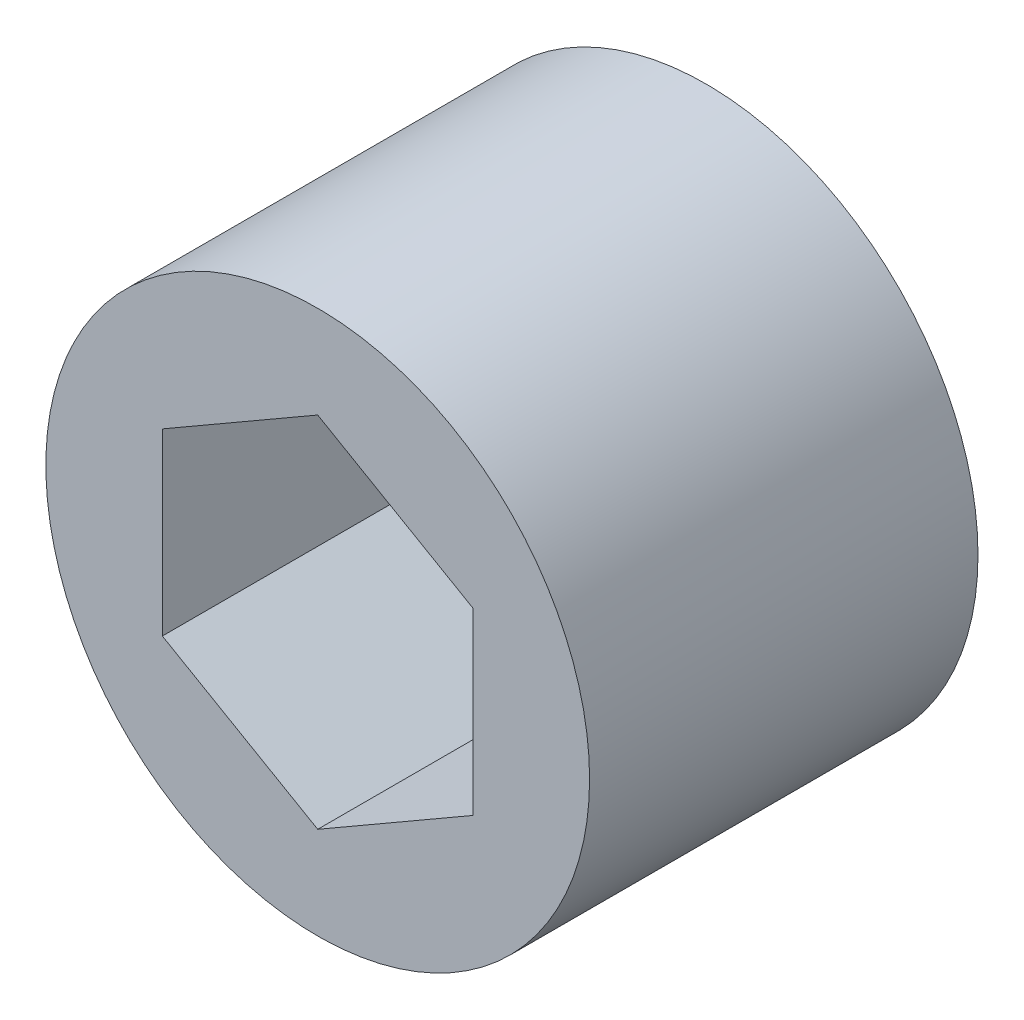
from build123d import *

# Parameters (mm, degrees)
SKETCH1_R           = 11.1125
BOSS_EXTRUDE1_DEPTH = 15.875
CUT_EXTRUDE1_DEPTH  = 0.4


with BuildPart() as part:
    # Sketch1 → Boss-Extrude1 (new body)
    with BuildSketch(Plane.XY):
        Circle(SKETCH1_R)
        Polygon((0, 7.332348419), (-6.35, 3.666174209), (-6.35, -3.666174209), (0, -7.332348419), (6.35, -3.666174209), (6.35, 3.666174209), align=None, mode=Mode.SUBTRACT)
    extrude(amount=BOSS_EXTRUDE1_DEPTH)

    # Sketch2 → Cut-Extrude1 (cut)
    # profile 1 of 4: a face of its own
    with BuildSketch(Plane(origin=(0, 0, 0), x_dir=(-1, 0, 0), z_dir=(0, 0, -1))):
        with BuildLine():
            add(Edge.make_bspline(
                [(-6.352447409, 5.46601662), (-6.367108142, 5.491759391), (-6.395621123, 5.541825319), (-6.434002282, 5.616497456), (-6.468359259, 5.687614023), (-6.497743051, 5.755548608), (-6.522422123, 5.820121118), (-6.542086985, 5.881464986), (-6.55767301, 5.939456115), (-6.568059534, 5.994678232), (-6.574440803, 6.047496191), (-6.577292558, 6.098295072), (-6.577661127, 6.147516254), (-6.573662053, 6.195089528), (-6.567271468, 6.241155527), (-6.556993719, 6.28547166), (-6.544280054, 6.328459991), (-6.527262591, 6.369391136), (-6.508350524, 6.408878349), (-6.485621715, 6.445581989), (-6.461447378, 6.480665288), (-6.434058564, 6.512892821), (-6.404712005, 6.543343079), (-6.372290353, 6.570922258), (-6.337760284, 6.596875684), (-6.31300831, 6.61189916), (-6.30050597, 6.61948759)],
                knots=[0, 0, 0, 0, 1.642146609, 3.193735178, 4.65339879, 6.019959045, 7.29583452, 8.483997703, 9.589852514, 10.622536898, 11.596230804, 12.537100014, 13.442089292, 14.322328697, 15.181380451, 16.017978509, 16.842123126, 17.663296608, 18.472766854, 19.266433458, 20.053886789, 20.832515994, 21.608242113, 22.395755133, 23.189688203, 24, 24, 24, 24], degree=3))
            add(Edge.make_bspline(
                [(-6.30050597, 6.61948759), (-6.28750665, 6.626634682), (-6.261735674, 6.640803695), (-6.221380783, 6.658035255), (-6.180735845, 6.672738376), (-6.139111256, 6.683516346), (-6.096922894, 6.690898355), (-6.053879725, 6.695019553), (-6.010214005, 6.695734269), (-5.965952996, 6.693054051), (-5.921342934, 6.687318732), (-5.876711205, 6.677119393), (-5.832178063, 6.663199823), (-5.78728422, 6.646325663), (-5.743036739, 6.624527381), (-5.698593396, 6.599476485), (-5.65401976, 6.571045705), (-5.60985049, 6.538081727), (-5.565178054, 6.50116605), (-5.520975463, 6.458862077), (-5.476577629, 6.411476758), (-5.432650593, 6.358832155), (-5.38886047, 6.300949976), (-5.344546027, 6.23833873), (-5.301005451, 6.17000965), (-5.272792391, 6.12229343), (-5.258338085, 6.097847132)],
                knots=[0, 0, 0, 0, 0.816106898, 1.617920902, 2.412419145, 3.193416184, 3.981325097, 4.767762218, 5.571164061, 6.382658378, 7.20678923, 8.044113261, 8.898964452, 9.773829128, 10.681145665, 11.610813622, 12.5814274, 13.588962241, 14.6427423, 15.769503862, 16.954284862, 18.215513191, 19.541650863, 20.948716096, 22.436745513, 24, 24, 24, 24], degree=3))
            add(Edge.make_bspline(
                [(-5.258338085, 6.097847132), (-5.244481112, 6.07318509), (-5.217455933, 6.025086842), (-5.180098696, 5.953550371), (-5.148010678, 5.884204459), (-5.119842282, 5.817618337), (-5.096549561, 5.753565937), (-5.077338141, 5.69209328), (-5.062820723, 5.633119837), (-5.052610272, 5.576476826), (-5.046929836, 5.521902926), (-5.043552399, 5.469397057), (-5.044594526, 5.418589453), (-5.047933533, 5.369446788), (-5.055598416, 5.32201595), (-5.0658179, 5.276193286), (-5.079575592, 5.232250503), (-5.096760015, 5.190275581), (-5.116623965, 5.150270336), (-5.139586254, 5.112689518), (-5.164239384, 5.0769568), (-5.191778572, 5.043657006), (-5.222545454, 5.013384724), (-5.255022619, 4.984723017), (-5.290173202, 4.95838192), (-5.31533625, 4.943177163), (-5.328088018, 4.935471915)],
                knots=[0, 0, 0, 0, 1.558572261, 3.039675171, 4.44500239, 5.767404933, 7.021920233, 8.19867626, 9.314183841, 10.366093107, 11.366862767, 12.335955634, 13.262731656, 14.164729598, 15.047477431, 15.907015182, 16.749641984, 17.580952634, 18.403702246, 19.207672054, 20.005351578, 20.794016824, 21.584181799, 22.380929523, 23.179510693, 24, 24, 24, 24], degree=3))
            add(Edge.make_bspline(
                [(-5.328088018, 4.935471915), (-5.340860293, 4.928497876), (-5.366220807, 4.914650288), (-5.405549591, 4.897067096), (-5.445898764, 4.883519617), (-5.486589696, 4.872472482), (-5.528121305, 4.865648403), (-5.570133031, 4.861391482), (-5.61293337, 4.860767204), (-5.65625854, 4.863202441), (-5.699746833, 4.869760417), (-5.743310401, 4.879121757), (-5.786420751, 4.893264302), (-5.829651288, 4.910251953), (-5.872741185, 4.931200275), (-5.915803105, 4.95565252), (-5.958528298, 4.984122906), (-6.001576223, 5.016069935), (-6.0443443, 5.053145793), (-6.08759947, 5.095363829), (-6.131241423, 5.143144176), (-6.174945248, 5.196837835), (-6.21921984, 5.255944024), (-6.263412052, 5.320910023), (-6.308618261, 5.391132786), (-6.337543193, 5.440552176), (-6.352447409, 5.46601662)],
                knots=[0, 0, 0, 0, 0.807491903, 1.603348545, 2.386916451, 3.167713854, 3.940658363, 4.719915701, 5.50935356, 6.313835313, 7.125313705, 7.947948844, 8.783651521, 9.640150085, 10.524255013, 11.440287308, 12.386399569, 13.372019105, 14.413529699, 15.525036669, 16.724996316, 18.002813491, 19.365932914, 20.822335035, 22.362637201, 24, 24, 24, 24], degree=3))
        make_face()
        with BuildLine():
            add(Edge.make_bspline(
                [(-6.199220162, 5.550235954), (-6.18648845, 5.528392015), (-6.161834291, 5.486092605), (-6.123879467, 5.425894145), (-6.086777338, 5.370668578), (-6.050967607, 5.32007539), (-6.015779664, 5.274683279), (-5.9811789, 5.234603071), (-5.947854359, 5.199079744), (-5.914974729, 5.168379546), (-5.882287075, 5.141731532), (-5.849614093, 5.118242129), (-5.816598714, 5.0978625), (-5.783536667, 5.080302079), (-5.750160831, 5.065725606), (-5.716647435, 5.053707842), (-5.682652667, 5.045336635), (-5.638131171, 5.037362842), (-5.583459741, 5.034309812), (-5.520286202, 5.040621033), (-5.460502213, 5.056215235), (-5.42439821, 5.074664273), (-5.406371187, 5.083876028)],
                knots=[0, 0, 0, 0, 1.475228016, 2.856686104, 4.15161897, 5.357081144, 6.47289893, 7.501387829, 8.445726694, 9.313720896, 10.124066195, 10.905058304, 11.660046733, 12.386348828, 13.08755313, 13.783651734, 14.460982071, 15.127735434, 16.421461315, 17.639985157, 18.821625413, 20, 20, 20, 20], degree=3))
            add(Edge.make_bspline(
                [(-5.406371187, 5.083876028), (-5.389196577, 5.094759252), (-5.354909138, 5.116486551), (-5.311793963, 5.160446333), (-5.274913343, 5.211060465), (-5.250718382, 5.259031175), (-5.235567388, 5.300757875), (-5.226257597, 5.333832299), (-5.220000988, 5.368492533), (-5.21618534, 5.404336081), (-5.215781399, 5.441788987), (-5.216997489, 5.480471538), (-5.221659262, 5.520609629), (-5.226528442, 5.547540166), (-5.229028272, 5.561366262)],
                knots=[0, 0, 0, 0, 1.337971097, 2.671129108, 4.032665881, 5.459843453, 6.198285547, 6.96065115, 7.724239053, 8.5201198, 9.33645292, 10.194052936, 11.072829554, 12, 12, 12, 12], degree=3))
            add(Edge.make_bspline(
                [(-5.229028272, 5.561366262), (-5.232530662, 5.578728772), (-5.239658842, 5.614065523), (-5.254478662, 5.667078109), (-5.271898019, 5.721466204), (-5.292594726, 5.776801269), (-5.316654413, 5.833108704), (-5.343270654, 5.890636158), (-5.373326373, 5.9493163), (-5.395463044, 5.988233444), (-5.406742198, 6.008062643)],
                knots=[0, 0, 0, 0, 0.879876913, 1.790754508, 2.73331625, 3.717259664, 4.725112015, 5.77538776, 6.866507818, 8, 8, 8, 8], degree=3))
            add(Edge.make_bspline(
                [(-5.406742198, 6.008062643), (-5.418214527, 6.027696076), (-5.440661139, 6.066110601), (-5.476094162, 6.120783234), (-5.510832774, 6.172280175), (-5.546066686, 6.219856304), (-5.581724372, 6.263457268), (-5.616906493, 6.303875654), (-5.652547165, 6.340199169), (-5.688245303, 6.372986792), (-5.723860028, 6.402244198), (-5.758981944, 6.428400536), (-5.794192991, 6.450737266), (-5.828999812, 6.470227515), (-5.863800539, 6.486071109), (-5.898205642, 6.498953509), (-5.932478988, 6.508320661), (-5.977145137, 6.51593515), (-6.031491491, 6.519069372), (-6.094247076, 6.513346398), (-6.153453113, 6.497606282), (-6.189222062, 6.479397437), (-6.207011378, 6.470341456)],
                knots=[0, 0, 0, 0, 1.327522451, 2.597413504, 3.803087542, 4.954092809, 6.052504639, 7.091116491, 8.08170511, 9.022070092, 9.919800897, 10.771882377, 11.577119672, 12.352806521, 13.099205072, 13.807429758, 14.495830891, 15.170113202, 16.450227669, 17.661618134, 18.837030004, 20, 20, 20, 20], degree=3))
            add(Edge.make_bspline(
                [(-6.207011378, 6.470341456), (-6.224172986, 6.459314494), (-6.258375281, 6.437338266), (-6.301793121, 6.393232092), (-6.339005074, 6.341975894), (-6.363075747, 6.293089048), (-6.379089013, 6.251110722), (-6.387683484, 6.217557563), (-6.394526072, 6.182906704), (-6.398689439, 6.146802253), (-6.399456285, 6.109349529), (-6.398653247, 6.070659896), (-6.394145074, 6.030823963), (-6.388058948, 5.989240744), (-6.378194821, 5.945338623), (-6.364324856, 5.898537886), (-6.346297305, 5.848509335), (-6.324786694, 5.794980809), (-6.299086515, 5.738391503), (-6.26956614, 5.678425582), (-6.236364061, 5.615091437), (-6.211853278, 5.572294133), (-6.199220162, 5.550235954)],
                knots=[0, 0, 0, 0, 1.186584607, 2.364808541, 3.584028067, 4.867913378, 5.52979883, 6.201670858, 6.884946004, 7.589109066, 8.317961587, 9.068444384, 9.84432244, 10.65432116, 11.518850237, 12.466086659, 13.499587148, 14.619373863, 15.830028341, 17.123623296, 18.517485242, 20, 20, 20, 20], degree=3))
        make_face(mode=Mode.SUBTRACT)
    # profile 2 of 4: a face of its own
    with BuildSketch(Plane(origin=(0, 0, 0), x_dir=(-1, 0, 0), z_dir=(0, 0, -1))):
        with BuildLine():
            add(Edge.make_bspline(
                [(-5.118638781, 6.178356363), (-5.133299513, 6.204099134), (-5.161812495, 6.254165063), (-5.200193654, 6.3288372), (-5.234550631, 6.399953767), (-5.263934423, 6.467888351), (-5.288613494, 6.532460861), (-5.308278357, 6.59380473), (-5.323864382, 6.651795858), (-5.334250905, 6.707017976), (-5.340632175, 6.759835935), (-5.34348393, 6.810634816), (-5.343852499, 6.859855998), (-5.339853425, 6.907429271), (-5.33346284, 6.953495271), (-5.323185091, 6.997811404), (-5.310471426, 7.040799735), (-5.293453963, 7.081730879), (-5.274541896, 7.121218093), (-5.251813087, 7.157921733), (-5.22763875, 7.193005031), (-5.200249936, 7.225232565), (-5.170903377, 7.255682823), (-5.138481725, 7.283262002), (-5.103951655, 7.309215428), (-5.079199682, 7.324238904), (-5.066697342, 7.331827333)],
                knots=[0, 0, 0, 0, 1.642146609, 3.193735178, 4.65339879, 6.019959045, 7.29583452, 8.483997703, 9.589852514, 10.622536898, 11.596230804, 12.537100014, 13.442089292, 14.322328697, 15.181380451, 16.017978509, 16.842123126, 17.663296608, 18.472766854, 19.266433458, 20.053886789, 20.832515994, 21.608242113, 22.395755133, 23.189688203, 24, 24, 24, 24], degree=3))
            add(Edge.make_bspline(
                [(-5.066697342, 7.331827333), (-5.053698022, 7.338974425), (-5.027927046, 7.353143439), (-4.987572155, 7.370374999), (-4.946927216, 7.385078119), (-4.905302628, 7.395856089), (-4.863114266, 7.403238099), (-4.820071097, 7.407359296), (-4.776405377, 7.408074012), (-4.732144368, 7.405393795), (-4.687534306, 7.399658475), (-4.642902577, 7.389459137), (-4.598369435, 7.375539567), (-4.553475592, 7.358665407), (-4.509228111, 7.336867125), (-4.464784768, 7.311816229), (-4.420211132, 7.283385448), (-4.376041862, 7.250421471), (-4.331369426, 7.213505794), (-4.287166834, 7.171201821), (-4.242769001, 7.123816501), (-4.198841965, 7.071171898), (-4.155051842, 7.013289719), (-4.110737399, 6.950678473), (-4.067196823, 6.882349393), (-4.038983763, 6.834633173), (-4.024529456, 6.810186875)],
                knots=[0, 0, 0, 0, 0.816106898, 1.617920902, 2.412419145, 3.193416184, 3.981325097, 4.767762218, 5.571164061, 6.382658378, 7.20678923, 8.044113261, 8.898964452, 9.773829128, 10.681145665, 11.610813622, 12.5814274, 13.588962241, 14.6427423, 15.769503862, 16.954284862, 18.215513191, 19.541650863, 20.948716096, 22.436745513, 24, 24, 24, 24], degree=3))
            add(Edge.make_bspline(
                [(-4.024529456, 6.810186875), (-4.010672484, 6.785524834), (-3.983647304, 6.737426585), (-3.946290068, 6.665890114), (-3.91420205, 6.596544202), (-3.886033654, 6.52995808), (-3.862740933, 6.46590568), (-3.843529513, 6.404433024), (-3.829012095, 6.34545958), (-3.818801644, 6.28881657), (-3.813121208, 6.23424267), (-3.809743771, 6.1817368), (-3.810785898, 6.130929197), (-3.814124904, 6.081786532), (-3.821789788, 6.034355694), (-3.832009272, 5.988533029), (-3.845766964, 5.944590247), (-3.862951387, 5.902615324), (-3.882815337, 5.862610079), (-3.905777626, 5.825029262), (-3.930430755, 5.789296543), (-3.957969944, 5.75599675), (-3.988736826, 5.725724468), (-4.021213991, 5.697062761), (-4.056364574, 5.670721664), (-4.081527621, 5.655516907), (-4.09427939, 5.647811658)],
                knots=[0, 0, 0, 0, 1.558572261, 3.039675171, 4.44500239, 5.767404933, 7.021920233, 8.19867626, 9.314183841, 10.366093107, 11.366862767, 12.335955634, 13.262731656, 14.164729598, 15.047477431, 15.907015182, 16.749641984, 17.580952634, 18.403702246, 19.207672054, 20.005351578, 20.794016824, 21.584181799, 22.380929523, 23.179510693, 24, 24, 24, 24], degree=3))
            add(Edge.make_bspline(
                [(-4.09427939, 5.647811658), (-4.107051665, 5.640837619), (-4.132412179, 5.626990031), (-4.171740963, 5.60940684), (-4.212090136, 5.595859361), (-4.252781068, 5.584812225), (-4.294312677, 5.577988147), (-4.336324403, 5.573731226), (-4.379124742, 5.573106947), (-4.422449912, 5.575542185), (-4.465938205, 5.582100161), (-4.509501773, 5.5914615), (-4.552612123, 5.605604045), (-4.59584266, 5.622591697), (-4.638932557, 5.643540019), (-4.681994477, 5.667992264), (-4.72471967, 5.69646265), (-4.767767594, 5.728409679), (-4.810535672, 5.765485536), (-4.853790842, 5.807703572), (-4.897432795, 5.85548392), (-4.94113662, 5.909177579), (-4.985411212, 5.968283767), (-5.029603424, 6.033249766), (-5.074809633, 6.103472529), (-5.103734565, 6.152891919), (-5.118638781, 6.178356363)],
                knots=[0, 0, 0, 0, 0.807491903, 1.603348545, 2.386916451, 3.167713854, 3.940658363, 4.719915701, 5.50935356, 6.313835313, 7.125313705, 7.947948844, 8.783651521, 9.640150085, 10.524255013, 11.440287308, 12.386399569, 13.372019105, 14.413529699, 15.525036669, 16.724996316, 18.002813491, 19.365932914, 20.822335035, 22.362637201, 24, 24, 24, 24], degree=3))
        make_face()
        with BuildLine():
            add(Edge.make_bspline(
                [(-4.965411534, 6.262575697), (-4.952679822, 6.240731759), (-4.928025663, 6.198432348), (-4.890070839, 6.138233888), (-4.852968709, 6.083008322), (-4.817158978, 6.032415134), (-4.781971036, 5.987023023), (-4.747370272, 5.946942814), (-4.714045731, 5.911419488), (-4.681166101, 5.88071929), (-4.648478447, 5.854071276), (-4.615805465, 5.830581873), (-4.582790086, 5.810202243), (-4.549728039, 5.792641822), (-4.516352203, 5.778065349), (-4.482838807, 5.766047585), (-4.448844039, 5.757676379), (-4.404322543, 5.749702586), (-4.349651113, 5.746649556), (-4.286477573, 5.752960777), (-4.226693584, 5.768554979), (-4.190589581, 5.787004017), (-4.172562559, 5.796215772)],
                knots=[0, 0, 0, 0, 1.475228016, 2.856686104, 4.15161897, 5.357081144, 6.47289893, 7.501387829, 8.445726694, 9.313720896, 10.124066195, 10.905058304, 11.660046733, 12.386348828, 13.08755313, 13.783651734, 14.460982071, 15.127735434, 16.421461315, 17.639985157, 18.821625413, 20, 20, 20, 20], degree=3))
            add(Edge.make_bspline(
                [(-4.172562559, 5.796215772), (-4.155387949, 5.807098996), (-4.121100509, 5.828826294), (-4.077985335, 5.872786077), (-4.041104715, 5.923400209), (-4.016909754, 5.971370918), (-4.00175876, 6.013097618), (-3.992448969, 6.046172042), (-3.98619236, 6.080832276), (-3.982376712, 6.116675825), (-3.981972771, 6.154128731), (-3.983188861, 6.192811281), (-3.987850634, 6.232949373), (-3.992719814, 6.25987991), (-3.995219644, 6.273706006)],
                knots=[0, 0, 0, 0, 1.337971097, 2.671129108, 4.032665881, 5.459843453, 6.198285547, 6.96065115, 7.724239053, 8.5201198, 9.33645292, 10.194052936, 11.072829554, 12, 12, 12, 12], degree=3))
            add(Edge.make_bspline(
                [(-3.995219644, 6.273706006), (-3.998722034, 6.291068515), (-4.005850214, 6.326405266), (-4.020670034, 6.379417853), (-4.038089391, 6.433805947), (-4.058786097, 6.489141013), (-4.082845785, 6.545448447), (-4.109462026, 6.602975901), (-4.139517745, 6.661656043), (-4.161654416, 6.700573188), (-4.17293357, 6.720402387)],
                knots=[0, 0, 0, 0, 0.879876913, 1.790754508, 2.73331625, 3.717259664, 4.725112015, 5.77538776, 6.866507818, 8, 8, 8, 8], degree=3))
            add(Edge.make_bspline(
                [(-4.17293357, 6.720402387), (-4.184405898, 6.74003582), (-4.206852511, 6.778450344), (-4.242285534, 6.833122978), (-4.277024145, 6.884619919), (-4.312258058, 6.932196048), (-4.347915744, 6.975797011), (-4.383097865, 7.016215398), (-4.418738537, 7.052538912), (-4.454436675, 7.085326536), (-4.4900514, 7.114583942), (-4.525173316, 7.140740279), (-4.560384363, 7.16307701), (-4.595191184, 7.182567258), (-4.629991911, 7.198410853), (-4.664397013, 7.211293252), (-4.69867036, 7.220660405), (-4.743336509, 7.228274893), (-4.797682863, 7.231409115), (-4.860438448, 7.225686142), (-4.919644485, 7.209946026), (-4.955413434, 7.19173718), (-4.97320275, 7.1826812)],
                knots=[0, 0, 0, 0, 1.327522451, 2.597413504, 3.803087542, 4.954092809, 6.052504639, 7.091116491, 8.08170511, 9.022070092, 9.919800897, 10.771882377, 11.577119672, 12.352806521, 13.099205072, 13.807429758, 14.495830891, 15.170113202, 16.450227669, 17.661618134, 18.837030004, 20, 20, 20, 20], degree=3))
            add(Edge.make_bspline(
                [(-4.97320275, 7.1826812), (-4.990364358, 7.171654238), (-5.024566652, 7.14967801), (-5.067984493, 7.105571835), (-5.105196446, 7.054315637), (-5.129267119, 7.005428791), (-5.145280385, 6.963450465), (-5.153874856, 6.929897307), (-5.160717444, 6.895246447), (-5.164880811, 6.859141997), (-5.165647656, 6.821689272), (-5.164844619, 6.78299964), (-5.160336446, 6.743163706), (-5.15425032, 6.701580488), (-5.144386193, 6.657678367), (-5.130516227, 6.610877629), (-5.112488677, 6.560849079), (-5.090978065, 6.507320553), (-5.065277886, 6.450731247), (-5.035757512, 6.390765325), (-5.002555433, 6.32743118), (-4.978044649, 6.284633877), (-4.965411534, 6.262575697)],
                knots=[0, 0, 0, 0, 1.186584607, 2.364808541, 3.584028067, 4.867913378, 5.52979883, 6.201670858, 6.884946004, 7.589109066, 8.317961587, 9.068444384, 9.84432244, 10.65432116, 11.518850237, 12.466086659, 13.499587148, 14.619373863, 15.830028341, 17.123623296, 18.517485242, 20, 20, 20, 20], degree=3))
        make_face(mode=Mode.SUBTRACT)
    # profile 3 of 4: a face of its own
    with BuildSketch(Plane(origin=(0, 0, 0), x_dir=(-1, 0, 0), z_dir=(0, 0, -1))):
        Polygon((-4.006150516, 7.89056882), (-3.691162785, 8.072363859), (-2.765121119, 6.469228425), (-2.92428453, 6.377217875), (-3.759428677, 7.823415959), (-4.010973649, 7.678350938), align=None)
    # profile 4 of 4: a face of its own
    with BuildSketch(Plane(origin=(0, 0, 0), x_dir=(-1, 0, 0), z_dir=(0, 0, -1))):
        with BuildLine():
            Line((-1.807715151, 6.967866246), (-1.988397159, 6.976770492))
            Line((-1.988397159, 6.976770492), (-1.934971679, 7.883148614))
            add(Edge.make_bspline(
                [(-1.934971679, 7.883148614), (-1.946623442, 7.870433919), (-1.969288705, 7.845701021), (-2.006103594, 7.813243662), (-2.042666278, 7.783968527), (-2.068726823, 7.768123177), (-2.08152074, 7.76034421)],
                knots=[0, 0, 0, 0, 1.077215196, 2.095422277, 3.064984682, 4, 4, 4, 4], degree=3))
            add(Edge.make_bspline(
                [(-2.08152074, 7.76034421), (-2.097313418, 7.751726524), (-2.128559927, 7.734676052), (-2.177630339, 7.715195752), (-2.227308114, 7.700769843), (-2.277752169, 7.692462787), (-2.328799598, 7.688494624), (-2.380565355, 7.690422594), (-2.432949567, 7.698125309), (-2.485377896, 7.710555556), (-2.536717435, 7.727854735), (-2.585572744, 7.749814209), (-2.631467207, 7.776257146), (-2.674219845, 7.807243883), (-2.714203482, 7.842292661), (-2.751040907, 7.881766532), (-2.784659021, 7.925892437), (-2.804271064, 7.95779001), (-2.81426605, 7.974046134)],
                knots=[0, 0, 0, 0, 1.014700259, 2.007629186, 2.973189836, 3.929139397, 4.888015433, 5.858935806, 6.846130973, 7.872173019, 8.896432606, 9.899347103, 10.890728972, 11.880733647, 12.874937698, 13.887402481, 14.923346105, 16, 16, 16, 16], degree=3))
            add(Edge.make_bspline(
                [(-2.81426605, 7.974046134), (-2.82654775, 7.997000217), (-2.850711714, 8.042161848), (-2.875178767, 8.114061204), (-2.891116372, 8.186752723), (-2.89549863, 8.260471085), (-2.891098, 8.334038248), (-2.875442442, 8.406248191), (-2.850320322, 8.476737934), (-2.815530297, 8.544502822), (-2.772315496, 8.608089686), (-2.72178062, 8.665506042), (-2.663989494, 8.715766067), (-2.620865233, 8.742833251), (-2.599080085, 8.756506821)],
                knots=[0, 0, 0, 0, 1.035043885, 2.036425051, 3.012843765, 3.989957597, 4.96707143, 5.938672781, 6.921477915, 7.938942164, 8.963306408, 9.975034649, 10.977045218, 12, 12, 12, 12], degree=3))
            add(Edge.make_bspline(
                [(-2.599080085, 8.756506821), (-2.576861184, 8.768394993), (-2.532921588, 8.791904775), (-2.462430956, 8.815836774), (-2.390103585, 8.830480529), (-2.316400354, 8.835614904), (-2.242613681, 8.831386771), (-2.170493924, 8.816685717), (-2.100553172, 8.792433699), (-2.034448672, 8.757746294), (-1.97252963, 8.715699829), (-1.916850108, 8.66652048), (-1.868318335, 8.61040503), (-1.842073533, 8.56864746), (-1.828862738, 8.547628031)],
                knots=[0, 0, 0, 0, 1.019824978, 2.016782805, 3.003623728, 4.003449708, 5.002622273, 5.989463196, 6.976952975, 7.992384263, 9.005785083, 10.003448133, 10.994999479, 12, 12, 12, 12], degree=3))
            add(Edge.make_bspline(
                [(-1.828862738, 8.547628031), (-1.819751807, 8.530596458), (-1.801210553, 8.495936256), (-1.779137923, 8.439931663), (-1.761456881, 8.379919588), (-1.749992845, 8.32703912), (-1.743242837, 8.282073359), (-1.738995916, 8.245460227), (-1.736779248, 8.206315235), (-1.73462763, 8.164646182), (-1.734488014, 8.120590506), (-1.735222294, 8.073958761), (-1.737056249, 8.024847641), (-1.739130689, 7.991232445), (-1.74019128, 7.974046134)],
                knots=[0, 0, 0, 0, 1.179517641, 2.400384276, 3.669978525, 4.99951221, 5.702757638, 6.447991837, 7.250775919, 8.098000084, 8.997311831, 9.942054579, 10.947842213, 12, 12, 12, 12], degree=3))
            Line((-1.74019128, 7.974046134), (-1.807715151, 6.967866246))
        make_face()
        with BuildLine():
            add(Edge.make_bspline(
                [(-2.126041974, 7.922104694), (-2.114631633, 7.929048341), (-2.092222562, 7.942685154), (-2.06172168, 7.966803446), (-2.033929114, 7.992699218), (-2.009830338, 8.021553323), (-1.988534877, 8.052460001), (-1.970346253, 8.085674353), (-1.954899476, 8.121108848), (-1.943436303, 8.1586408), (-1.934651666, 8.196924419), (-1.930451018, 8.235373213), (-1.929037843, 8.273244934), (-1.932042997, 8.310718373), (-1.939308366, 8.347419825), (-1.949625058, 8.38380259), (-1.964197482, 8.419564347), (-1.976556446, 8.442491587), (-1.982832005, 8.45413344)],
                knots=[0, 0, 0, 0, 1.045108442, 2.052516081, 3.039037663, 4.014948609, 4.990090363, 5.974041511, 6.976128051, 8.011453109, 9.043011603, 10.047295345, 11.035574291, 12.007150616, 12.98344593, 13.961229243, 14.964765542, 16, 16, 16, 16], degree=3))
            add(Edge.make_bspline(
                [(-1.982832005, 8.45413344), (-1.989653825, 8.465416736), (-2.003136579, 8.487717222), (-2.027040244, 8.518075796), (-2.053187982, 8.545499459), (-2.081889442, 8.569627358), (-2.112833712, 8.590863353), (-2.145937951, 8.609181892), (-2.181563584, 8.624046618), (-2.21897833, 8.635705462), (-2.257317291, 8.644231982), (-2.295688945, 8.649241148), (-2.333620826, 8.649899412), (-2.371017189, 8.646909623), (-2.408006438, 8.640311532), (-2.444433059, 8.629266478), (-2.480679677, 8.615048132), (-2.503613102, 8.602311879), (-2.515231761, 8.595859368)],
                knots=[0, 0, 0, 0, 1.031712043, 2.039092063, 3.018573684, 3.994457873, 4.969572892, 5.953497063, 6.951758218, 7.98705489, 9.018585102, 10.024008046, 11.012022604, 11.983572292, 12.958061913, 13.947831088, 14.960318852, 16, 16, 16, 16], degree=3))
            add(Edge.make_bspline(
                [(-2.515231761, 8.595859368), (-2.526538619, 8.589066152), (-2.548802198, 8.575690083), (-2.578826403, 8.551395342), (-2.606624143, 8.525658113), (-2.630669515, 8.496761565), (-2.652069435, 8.465982583), (-2.669732408, 8.432548513), (-2.685290914, 8.397242459), (-2.696716301, 8.359689877), (-2.705511373, 8.321411789), (-2.709694821, 8.283084667), (-2.711121225, 8.245337798), (-2.708115487, 8.207987656), (-2.700852935, 8.171286271), (-2.690535483, 8.134903489), (-2.675963266, 8.099141736), (-2.663604273, 8.076214496), (-2.6573287, 8.064572643)],
                knots=[0, 0, 0, 0, 1.034021631, 2.036022986, 3.024725885, 4.002794686, 4.980092595, 5.961574923, 6.965877195, 8.00349148, 9.037330872, 10.043835206, 11.024597356, 11.998321951, 12.97677597, 13.956721278, 14.962476515, 16, 16, 16, 16], degree=3))
            add(Edge.make_bspline(
                [(-2.6573287, 8.064572643), (-2.650507176, 8.053288896), (-2.637025007, 8.030987521), (-2.613117074, 8.000635437), (-2.586985019, 7.973187921), (-2.55830371, 7.94921367), (-2.527667715, 7.927695908), (-2.494489595, 7.909636198), (-2.459069778, 7.894167333), (-2.421533744, 7.882710301), (-2.383251221, 7.873924015), (-2.344802142, 7.869723796), (-2.306930496, 7.868310508), (-2.269457037, 7.871315692), (-2.23275559, 7.878581054), (-2.196372824, 7.888897748), (-2.160611067, 7.90347017), (-2.137683827, 7.915829135), (-2.126041974, 7.922104694)],
                knots=[0, 0, 0, 0, 1.033571637, 2.042767394, 3.024014467, 4.001657624, 4.970548117, 5.956245748, 6.96011096, 7.997273687, 9.030663166, 10.03672948, 11.026762591, 12.000063433, 12.97809164, 13.957610489, 14.962928033, 16, 16, 16, 16], degree=3))
        make_face(mode=Mode.SUBTRACT)
    extrude(amount=-CUT_EXTRUDE1_DEPTH, mode=Mode.SUBTRACT)


solid = part.part
